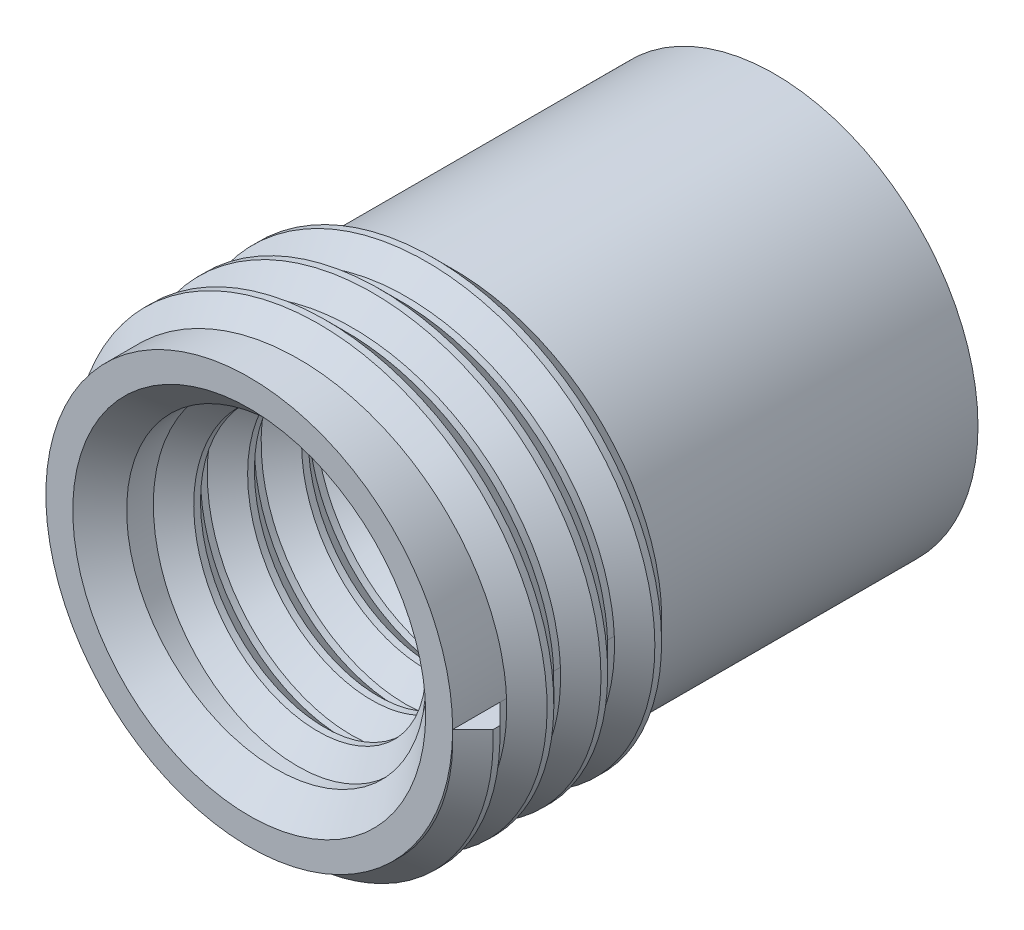
from build123d import *

# Parameters (mm, degrees)
SKETCH_1_R            = 15.1
EXTRUDE_1_DEPTH       = 39
SWEEP_1_PITCH         = 4
SKETCH_4_R            = 11.1
CUT_EXTRUDE_695_DEPTH = 46.520544971
SWEEP_2_PITCH         = 4


with BuildPart() as part:
    # 草图1 → 凸台-拉伸1 (new body)
    with BuildSketch(Plane.XY):
        Circle(SKETCH_1_R)
    extrude(amount=EXTRUDE_1_DEPTH)

    # 扫描1: the profile of 草图3 profile screwed along a right-hand helix of 3.5 turns, 12 arcs to a turn; built about Z, then put on its axis
    sweep_1_z = Axis((0, 0, 0), (0, 0, 1))
    sweep_1_corners = [(15.0997, 0, 1.7503), (15.0997, 0, -1.7503), (16.6, 0, -0.25), (16.6, 0, 0.25)]
    with BuildLine(mode=Mode.PRIVATE) as sweep_1_profile:
        Line(sweep_1_corners[0], sweep_1_corners[1])
        Line(sweep_1_corners[1], sweep_1_corners[2])
        Line(sweep_1_corners[2], sweep_1_corners[3])
        Line(sweep_1_corners[3], sweep_1_corners[0])
    sweep_1_cap = Face(sweep_1_profile.wire())
    sweep_1_turn_angles = [0, 15, 30, 45, 60, 75, 90, 105, 120, 135, 150, 165, 180, 195, 210, 225, 240, 255, 270, 285, 300, 315, 330, 345, 360]
    sweep_1_turn_weights = [1, 0.9659258262890683, 1, 0.9659258262890683, 1, 0.9659258262890683, 1, 0.9659258262890683, 1, 0.9659258262890683, 1, 0.9659258262890683, 1, 0.9659258262890683, 1, 0.9659258262890683, 1, 0.9659258262890683, 1, 0.9659258262890683, 1, 0.9659258262890683, 1, 0.9659258262890683, 1]
    sweep_1_turn_rails = [Edge.make_bspline([Vector(p[0], p[1], 0).rotate(sweep_1_z, sweep_1_turn_angles[k]) / sweep_1_turn_weights[k] + Vector(0, 0, p[2] + SWEEP_1_PITCH * sweep_1_turn_angles[k] / 360) for k in range(25)], [0, 0, 0, 1, 1, 2, 2, 3, 3, 4, 4, 5, 5, 6, 6, 7, 7, 8, 8, 9, 9, 10, 10, 11, 11, 12, 12, 12], 2, sweep_1_turn_weights) for p in sweep_1_corners]
    sweep_1_turn_sides = [Face.make_surface_from_curves(sweep_1_turn_rails[p[0]], sweep_1_turn_rails[p[1]]) for p in [(0, 1), (1, 2), (2, 3), (3, 0)]]
    sweep_1_last_angles = [1080, 1095, 1110, 1125, 1140, 1155, 1170, 1185, 1200, 1215, 1230, 1245, 1260]
    sweep_1_last_weights = [1, 0.9659258262890683, 1, 0.9659258262890683, 1, 0.9659258262890683, 1, 0.9659258262890683, 1, 0.9659258262890683, 1, 0.9659258262890605, 1]
    sweep_1_last_rails = [Edge.make_bspline([Vector(p[0], p[1], 0).rotate(sweep_1_z, sweep_1_last_angles[k]) / sweep_1_last_weights[k] + Vector(0, 0, p[2] + SWEEP_1_PITCH * sweep_1_last_angles[k] / 360) for k in range(13)], [0, 0, 0, 1, 1, 2, 2, 3, 3, 4, 4, 5, 5, 6, 6, 6], 2, sweep_1_last_weights) for p in sweep_1_corners]
    sweep_1_last_sides = [Face.make_surface_from_curves(sweep_1_last_rails[p[0]], sweep_1_last_rails[p[1]]) for p in [(0, 1), (1, 2), (2, 3), (3, 0)]]
    sweep_1 = Plane(origin=(0, 0, 37.25), x_dir=(1, 0, 0), z_dir=(0, 0, -1)) * Solid(Shell([*[p.moved(Location((0, 0, SWEEP_1_PITCH * i))) for i in range(3) for p in sweep_1_turn_sides], *sweep_1_last_sides, sweep_1_cap, sweep_1_cap.rotate(sweep_1_z, 1260).moved(Location((0, 0, SWEEP_1_PITCH * 1260 / 360)))]))
    add(sweep_1)

    # 草图4 → Cut-Extrude 695 (cut, through all)
    with BuildSketch(Plane.XY.offset(39)):
        Circle(SKETCH_4_R)
    extrude(amount=-CUT_EXTRUDE_695_DEPTH, mode=Mode.SUBTRACT)

    # 草图8 → 切除-旋转1 (revolve, cut)
    with BuildSketch(Plane(origin=(0, 0, 0), x_dir=(1, 0, 0), z_dir=(0, 1, 0)), mode=Mode.PRIVATE) as cut_revolve_1_sk:
        Polygon((-11.1, -37), (-11.1, -39), (-13.1, -39), align=None)
    revolve(cut_revolve_1_sk.sketch.rotate(Axis((0, 0, 0), (0, 0, -1)), 180), axis=Axis((0, 0, 0), (0, 0, -1)), mode=Mode.SUBTRACT)

    # 扫描2: the profile of 草图10 profile screwed along a right-hand helix of 3.5 turns, 12 arcs to a turn; built about Z, then put on its axis
    sweep_2_z = Axis((0, 0, 0), (0, 0, 1))
    sweep_2_corners = [(11.1003, 0, 1.7503), (11.1003, 0, -1.7503), (9.6, 0, -0.25), (9.6, 0, 0.25)]
    with BuildLine(mode=Mode.PRIVATE) as sweep_2_profile:
        Line(sweep_2_corners[0], sweep_2_corners[1])
        Line(sweep_2_corners[1], sweep_2_corners[2])
        Line(sweep_2_corners[2], sweep_2_corners[3])
        Line(sweep_2_corners[3], sweep_2_corners[0])
    sweep_2_cap = Face(sweep_2_profile.wire())
    sweep_2_turn_angles = [0, 15, 30, 45, 60, 75, 90, 105, 120, 135, 150, 165, 180, 195, 210, 225, 240, 255, 270, 285, 300, 315, 330, 345, 360]
    sweep_2_turn_weights = [1, 0.9659258262890683, 1, 0.9659258262890683, 1, 0.9659258262890683, 1, 0.9659258262890683, 1, 0.9659258262890683, 1, 0.9659258262890683, 1, 0.9659258262890683, 1, 0.9659258262890683, 1, 0.9659258262890683, 1, 0.9659258262890683, 1, 0.9659258262890683, 1, 0.9659258262890683, 1]
    sweep_2_turn_rails = [Edge.make_bspline([Vector(p[0], p[1], 0).rotate(sweep_2_z, sweep_2_turn_angles[k]) / sweep_2_turn_weights[k] + Vector(0, 0, p[2] + SWEEP_2_PITCH * sweep_2_turn_angles[k] / 360) for k in range(25)], [0, 0, 0, 1, 1, 2, 2, 3, 3, 4, 4, 5, 5, 6, 6, 7, 7, 8, 8, 9, 9, 10, 10, 11, 11, 12, 12, 12], 2, sweep_2_turn_weights) for p in sweep_2_corners]
    sweep_2_turn_sides = [Face.make_surface_from_curves(sweep_2_turn_rails[p[0]], sweep_2_turn_rails[p[1]]) for p in [(0, 1), (1, 2), (2, 3), (3, 0)]]
    sweep_2_last_angles = [1080, 1095, 1110, 1125, 1140, 1155, 1170, 1185, 1200, 1215, 1230, 1245, 1260]
    sweep_2_last_weights = [1, 0.9659258262890683, 1, 0.9659258262890683, 1, 0.9659258262890683, 1, 0.9659258262890683, 1, 0.9659258262890683, 1, 0.9659258262890605, 1]
    sweep_2_last_rails = [Edge.make_bspline([Vector(p[0], p[1], 0).rotate(sweep_2_z, sweep_2_last_angles[k]) / sweep_2_last_weights[k] + Vector(0, 0, p[2] + SWEEP_2_PITCH * sweep_2_last_angles[k] / 360) for k in range(13)], [0, 0, 0, 1, 1, 2, 2, 3, 3, 4, 4, 5, 5, 6, 6, 6], 2, sweep_2_last_weights) for p in sweep_2_corners]
    sweep_2_last_sides = [Face.make_surface_from_curves(sweep_2_last_rails[p[0]], sweep_2_last_rails[p[1]]) for p in [(0, 1), (1, 2), (2, 3), (3, 0)]]
    sweep_2 = Plane(origin=(0, 0, 35.25), x_dir=(1, 0, 0), z_dir=(0, 0, -1)) * Solid(Shell([*[p.moved(Location((0, 0, SWEEP_2_PITCH * i))) for i in range(3) for p in sweep_2_turn_sides], *sweep_2_last_sides, sweep_2_cap, sweep_2_cap.rotate(sweep_2_z, 1260).moved(Location((0, 0, SWEEP_2_PITCH * 1260 / 360)))]))
    add(sweep_2)


solid = part.part
